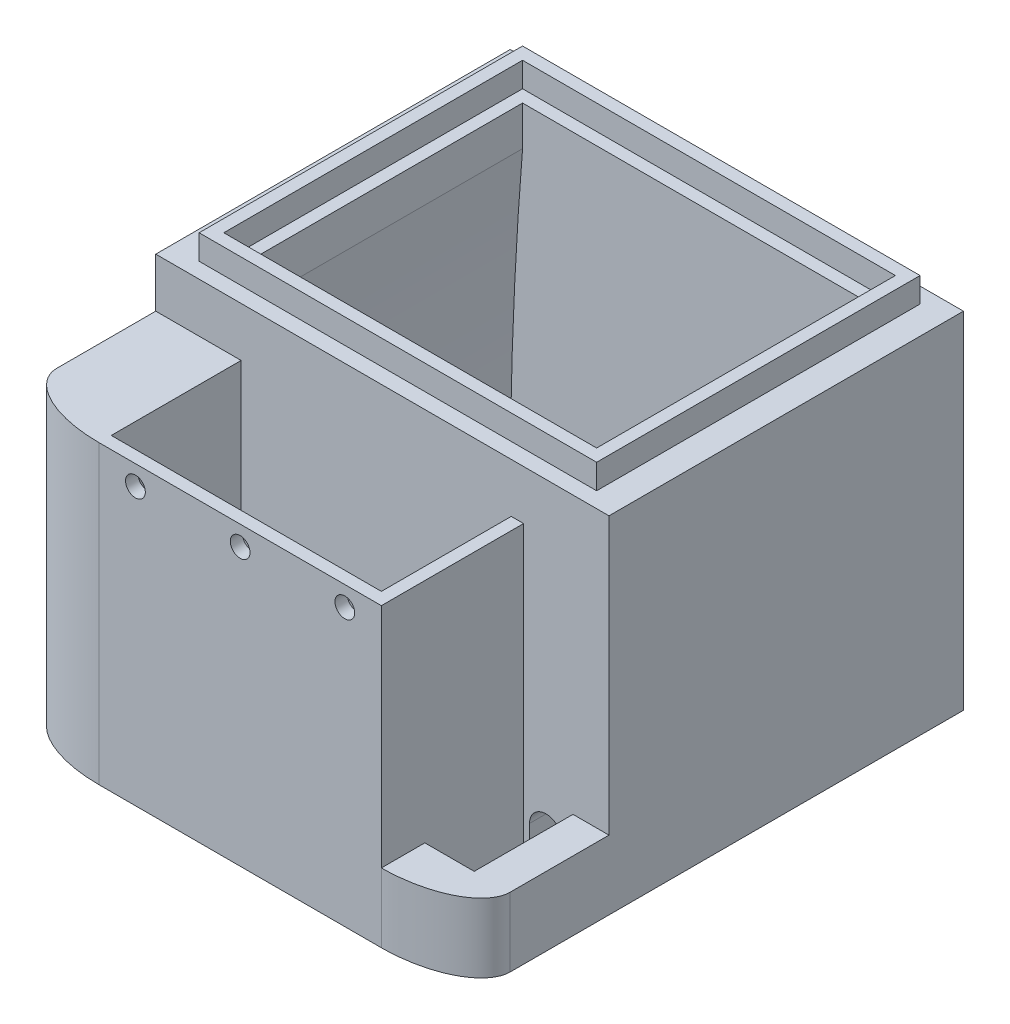
from build123d import *

# Parameters (mm, degrees)
SKETCH3_W            = 55.1053
SKETCH3_H            = 45.5803
BOSS_EXTRUDE2_DEPTH  = 44.45
SKETCH11_W           = 51.1175
SKETCH11_H           = 41.5925
SKETCH11_W_2         = 47.9425
SKETCH11_H_2         = 38.4175
BOSS_EXTRUDE3_DEPTH  = 3.175
SKETCH13_W           = 44.7675
SKETCH13_H           = 35.2425
CUT_EXTRUDE3_DEPTH   = 73.294764944
CUT_EXTRUDE4_DEPTH   = 5.1689
SKETCH19_W           = 1.5875
SKETCH19_H           = 45.5803
BOSS_EXTRUDE4_DEPTH  = 44.45
SKETCH21_W           = 1.5875
SKETCH21_H           = 35.2425
CUT_EXTRUDE5_DEPTH   = 39.37
FILLET1_R            = 482.6
FILLET2_R            = 482.6
SKETCH22_R           = 1.524
CUT_EXTRUDE7_DEPTH   = 3.175
BOSS_EXTRUDE5_DEPTH  = 38.1
SKETCH39_R           = 1.27
CUT_EXTRUDE14_DEPTH  = 3.81
BOSS_EXTRUDE22_DEPTH = 8.89
SKETCH48_W           = 18.288
SKETCH48_H           = 29.21
BOSS_EXTRUDE23_DEPTH = 1.5875


with BuildPart() as part:
    # Sketch3 → Boss-Extrude2 (new body)
    with BuildSketch(Plane(origin=(0, 0, 0), x_dir=(1, 0, 0), z_dir=(0, 1, 0))):
        with Locations((6.69887245, -22.79015)):
            Rectangle(SKETCH3_W, SKETCH3_H)
    extrude(amount=BOSS_EXTRUDE2_DEPTH)

    # Sketch11 → Boss-Extrude3 (add)
    with BuildSketch(Plane(origin=(0, 44.45, 0), x_dir=(1, 0, 0), z_dir=(0, 1, 0))):
        with Locations((6.69887245, -22.79015)):
            Rectangle(SKETCH11_W, SKETCH11_H)
        with Locations((6.69887245, -22.79015)):
            Rectangle(SKETCH11_W_2, SKETCH11_H_2, mode=Mode.SUBTRACT)
    extrude(amount=BOSS_EXTRUDE3_DEPTH)

    # Sketch13 → Cut-Extrude3 (cut, through all)
    with BuildSketch(Plane(origin=(0, 44.45, 0), x_dir=(1, 0, 0), z_dir=(0, 1, 0))):
        with Locations((6.69887245, -22.79015)):
            Rectangle(SKETCH13_W, SKETCH13_H)
    extrude(amount=-CUT_EXTRUDE3_DEPTH, mode=Mode.SUBTRACT)

    # Sketch14 → Cut-Extrude4 (cut)
    with BuildSketch(Plane.XY.offset(45.5803)):
        with BuildLine():
            Line((-2.82612755, 6.35), (-2.82612755, 0))
            Line((-2.82612755, 0), (3.52387245, 0))
            Line((3.52387245, 0), (3.52387245, 6.35))
            ThreePointArc((3.52387245, 6.35), (0.34887245, 9.525), (-2.82612755, 6.35))
        make_face()
        with BuildLine():
            Line((9.87387245, 6.35), (9.87387245, 0))
            Line((9.87387245, 0), (16.22387245, 0))
            Line((16.22387245, 0), (16.22387245, 6.35))
            ThreePointArc((16.22387245, 6.35), (13.04887245, 9.525), (9.87387245, 6.35))
        make_face()
        with BuildLine():
            Line((25.618069301, 0), (29.87637245, 0))
            Line((29.87637245, 0), (29.87637245, 5.08))
            ThreePointArc((29.87637245, 5.08), (27.747220876, 7.209151575), (25.618069301, 5.08))
            Line((25.618069301, 5.08), (25.618069301, 0))
        make_face()
    extrude(amount=-CUT_EXTRUDE4_DEPTH, mode=Mode.SUBTRACT)

    # Sketch19 → Boss-Extrude4 (add)
    with BuildSketch(Plane.XZ):
        with Locations((-21.64752755, 22.79015)):
            Rectangle(SKETCH19_W, SKETCH19_H)
        with Locations((35.04527245, 22.79015)):
            Rectangle(SKETCH19_W, SKETCH19_H)
    extrude(amount=-BOSS_EXTRUDE4_DEPTH)

    # Sketch21 → Cut-Extrude5 (cut)
    with BuildSketch(Plane(origin=(0, 0, 0), x_dir=(-1, 0, 0), z_dir=(0, -1, 0))):
        with Locations((16.47862755, -22.79015)):
            Rectangle(SKETCH21_W, SKETCH21_H)
        with Locations((-29.87637245, -22.79015)):
            Rectangle(SKETCH21_W, SKETCH21_H)
    extrude(amount=-CUT_EXTRUDE5_DEPTH, mode=Mode.SUBTRACT)

    # Fillet1
    # the kernel refuses this fillet: 482.6 mm, written as the material it adds along each edge
    with BuildSketch(Plane(origin=(-17.27237755, 39.37, 40.4114), x_dir=(1, 0, 0), z_dir=(0, 0, -1))) as fillet1_piece_1:
        with BuildLine():
            CenterArc((482.6, 39.111824858), FILLET1_R, 180, 4.648576264)
            Line((0, 39.111824858), (0, 0))
            Line((0, 0), (1.5875, 0))
        make_face()
    extrude(amount=35.2425)

    # Fillet2
    # the kernel refuses this fillet: 482.6 mm, written as the material it adds along each edge
    with BuildSketch(Plane(origin=(30.67012245, 39.37, 138.190962146), x_dir=(0, -1, 0), z_dir=(0, 0, -1))) as fillet2_piece_1_section:
        with BuildLine():
            CenterArc((39.111824858, 482.6), FILLET2_R, 265.351423736, 4.648576264)
            Line((0, 1.5875), (0, 0))
            Line((0, 0), (39.111824858, 0))
        make_face()
    fillet2_piece_1 = extrude(amount=230.801624292, mode=Mode.PRIVATE)
    fillet2_piece_1 = split(fillet2_piece_1, bisect_by=Plane(origin=(30.67012245, 39.37, 45.5803), z_dir=(0, 0, -1)), keep=Keep.TOP, mode=Mode.PRIVATE)
    fillet2_piece_1 = split(fillet2_piece_1, bisect_by=Plane(origin=(30.67012245, 39.37, 0), z_dir=(0, 0, 1)), keep=Keep.TOP, mode=Mode.PRIVATE)
    add(fillet2_piece_1)

    # Sketch22 → Cut-Extrude7 (cut)
    with BuildSketch(Plane.XZ):
        with Locations(Location((-19.39327755, 42.5323, 0), (0, 0, 270))):
            Circle(SKETCH22_R)
        with Locations(Location((32.79102245, 42.5323, 0), (0, 0, 270))):
            Circle(SKETCH22_R)
        with Locations(Location((-19.39327755, 3.048, 0), (0, 0, 270))):
            Circle(SKETCH22_R)
        with Locations(Location((32.79102245, 3.048, 0), (0, 0, 270))):
            Circle(SKETCH22_R)
    extrude(amount=-CUT_EXTRUDE7_DEPTH, mode=Mode.SUBTRACT)

    # Sketch23 → Boss-Extrude5 (add)
    with BuildSketch(Plane.XZ):
        with BuildLine():
            Line((24.85987245, 63.8683), (-11.46212755, 63.8683))
            add(Edge.make_bspline(
                [(-11.46212755, 63.8683), (-22.44127755, 63.8683), (-22.44127755, 58.2803)],
                knots=[4.71238898, 4.71238898, 4.71238898, 6.283185307, 6.283185307, 6.283185307], degree=2, weights=[1, 0.707106781, 1]))
            Line((-22.44127755, 58.2803), (-22.44127755, 45.5803))
            Line((-22.44127755, 45.5803), (-20.85377755, 45.5803))
            Line((-20.85377755, 45.5803), (-11.46212755, 45.5803))
            Line((-11.46212755, 45.5803), (-11.46212755, 62.2808))
            Line((-11.46212755, 62.2808), (24.85987245, 62.2808))
            Line((24.85987245, 62.2808), (24.85987245, 63.8683))
        make_face()
    extrude(amount=-BOSS_EXTRUDE5_DEPTH)

    # Sketch39 → Cut-Extrude14 (cut)
    with BuildSketch(Plane.XY.offset(63.8683)):
        with Locations((6.69887245, 35.56)):
            Circle(SKETCH39_R)
        with Locations((-6.76312755, 35.56)):
            Circle(SKETCH39_R)
        with Locations((20.16087245, 35.56)):
            Circle(SKETCH39_R)
    extrude(amount=-CUT_EXTRUDE14_DEPTH, mode=Mode.SUBTRACT)

    # Sketch43 → Boss-Extrude22 (add)
    with BuildSketch(Plane.XZ):
        with BuildLine():
            Line((31.20987245, 45.5803), (35.83902245, 45.5803))
            Line((35.83902245, 45.5803), (35.83902245, 58.2803))
            add(Edge.make_bspline(
                [(35.83902245, 58.2803), (35.83902245, 63.8683), (24.85987245, 63.8683)],
                knots=[3.141592654, 3.141592654, 3.141592654, 4.71238898, 4.71238898, 4.71238898], degree=2, weights=[1, 0.707106781, 1]))
            Line((24.85987245, 63.8683), (24.85987245, 62.2808))
            Line((24.85987245, 62.2808), (23.27237245, 62.2808))
            Line((23.27237245, 62.2808), (23.27237245, 45.5803))
            Line((23.27237245, 45.5803), (24.85987245, 45.5803))
            Line((24.85987245, 45.5803), (24.85987245, 58.2803))
            Line((24.85987245, 58.2803), (31.20987245, 58.2803))
            Line((31.20987245, 58.2803), (31.20987245, 45.5803))
        make_face()
    extrude(amount=-BOSS_EXTRUDE22_DEPTH)

    # Sketch48 → Boss-Extrude23 (add)
    with BuildSketch(Plane(origin=(24.85987245, 0, 0), x_dir=(0, 0, -1), z_dir=(1, 0, 0))):
        with Locations((-54.7243, 23.495)):
            Rectangle(SKETCH48_W, SKETCH48_H)
    extrude(amount=-BOSS_EXTRUDE23_DEPTH)


solid = part.part
